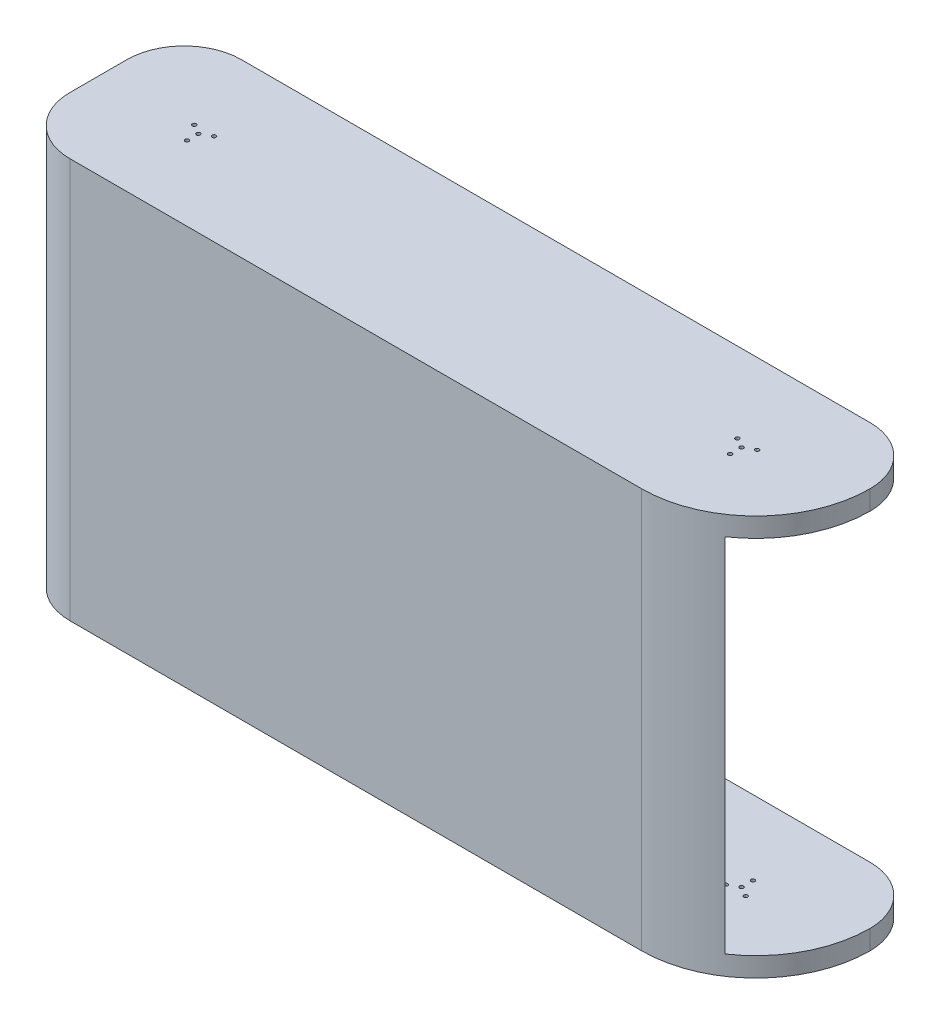
from build123d import *

# Parameters (mm, degrees)
SKETCH1_W           = 1300
SKETCH1_H           = 300
BOSS_EXTRUDE1_DEPTH = 700
FILLET1_R           = 200
FILLET2_R           = 100
FILLET3_R           = 100
FILLET4_R           = 100
SKETCH3_R           = 3.4
CUT_EXTRUDE1_DEPTH  = 100
CUT_EXTRUDE2_START  = -100
SKETCH4_R           = 3.4
CUT_EXTRUDE2_DEPTH  = 100
SKETCH5_W           = 631.976111166
SKETCH5_H           = 319.581114146
CUT_EXTRUDE4_DEPTH  = 1410
SKETCH6_W           = 352.69600487
SKETCH6_H           = 35.021102412
BOSS_EXTRUDE2_DEPTH = 631.976111165


with BuildPart() as part:
    # Sketch1 → Boss-Extrude1 (new body)
    with BuildSketch(Plane(origin=(0, 0, 0), x_dir=(-1, 0, 0), z_dir=(0, 1, 0))):
        Rectangle(SKETCH1_W, SKETCH1_H)
    extrude(amount=BOSS_EXTRUDE1_DEPTH)

    # Fillet1
    fillet1_edges = [part.edges().sort_by_distance(p)[0] for p in [
        (650, 350, 150),
    ]]
    fillet(fillet1_edges, radius=FILLET1_R)

    # Fillet2
    fillet2_edges = [part.edges().sort_by_distance(p)[0] for p in [
        (650, 350, -150),
    ]]
    fillet(fillet2_edges, radius=FILLET2_R - 0.0001)  # a hair under: the kernel refuses the full size

    # Fillet3
    fillet3_edges = [part.edges().sort_by_distance(p)[0] for p in [
        (-650, 350, 150),
    ]]
    fillet(fillet3_edges, radius=FILLET3_R)

    # Fillet4
    fillet4_edges = [part.edges().sort_by_distance(p)[0] for p in [
        (-650, 350, -150),
    ]]
    fillet(fillet4_edges, radius=FILLET4_R)

    # Sketch3 → Cut-Extrude1 (cut)
    with BuildSketch(Plane.XZ):
        with Locations(Location((475, 0, 0), (0, 0, 270))):
            Circle(SKETCH3_R)
        with Locations(Location((492.320508076, 10, 0), (0, 0, 270))):
            Circle(SKETCH3_R)
        with Locations(Location((457.679491924, 10, 0), (0, 0, 270))):
            Circle(SKETCH3_R)
        with Locations(Location((475, -20, 0), (0, 0, 270))):
            Circle(SKETCH3_R)
        with Locations(Location((-475, 0, 0), (0, 0, 270))):
            Circle(SKETCH3_R)
        with Locations(Location((-457.679491924, 10, 0), (0, 0, 270))):
            Circle(SKETCH3_R)
        with Locations(Location((-492.320508076, 10, 0), (0, 0, 270))):
            Circle(SKETCH3_R)
        with Locations(Location((-475, -20, 0), (0, 0, 270))):
            Circle(SKETCH3_R)
    extrude(amount=-CUT_EXTRUDE1_DEPTH, mode=Mode.SUBTRACT)

    # Sketch4 → Cut-Extrude2 (cut)
    with BuildSketch(Plane(origin=(0, 700, 0), x_dir=(-1, 0, 0), z_dir=(0, 1, 0)).offset(CUT_EXTRUDE2_START)):
        with Locations(Location((-475, 0, 0), (0, 0, 270))):
            Circle(SKETCH4_R)
        with Locations(Location((-475, 20, 0), (0, 0, 90))):
            Circle(SKETCH4_R)
        with Locations(Location((-492.320508076, -10, 0), (0, 0, 90))):
            Circle(SKETCH4_R)
        with Locations(Location((-457.679491924, -10, 0), (0, 0, 90))):
            Circle(SKETCH4_R)
        with Locations(Location((475, 0, 0), (0, 0, 270))):
            Circle(SKETCH4_R)
        with Locations(Location((475, 20, 0), (0, 0, 90))):
            Circle(SKETCH4_R)
        with Locations(Location((457.679491924, -10, 0), (0, 0, 90))):
            Circle(SKETCH4_R)
        with Locations(Location((492.320508076, -10, 0), (0, 0, 90))):
            Circle(SKETCH4_R)
    extrude(amount=CUT_EXTRUDE2_DEPTH, mode=Mode.SUBTRACT)

    # Sketch5 → Cut-Extrude4 (cut)
    with BuildSketch(Plane(origin=(-650, 0, 0), x_dir=(0, -1, 0), z_dir=(-1, 0, 0))):
        with Locations((-350, -43.959211894)):
            Rectangle(SKETCH5_W, SKETCH5_H)
    extrude(amount=-CUT_EXTRUDE4_DEPTH, mode=Mode.SUBTRACT)

    # Sketch6 → Boss-Extrude2 (add)
    with BuildSketch(Plane(origin=(0, 34.011944417, 0), x_dir=(-1, 0, 0), z_dir=(0, 1, 0))):
        with Locations((26.80489637, -132.489448794)):
            Rectangle(SKETCH6_W, SKETCH6_H)
    extrude(amount=BOSS_EXTRUDE2_DEPTH)


solid = part.part
